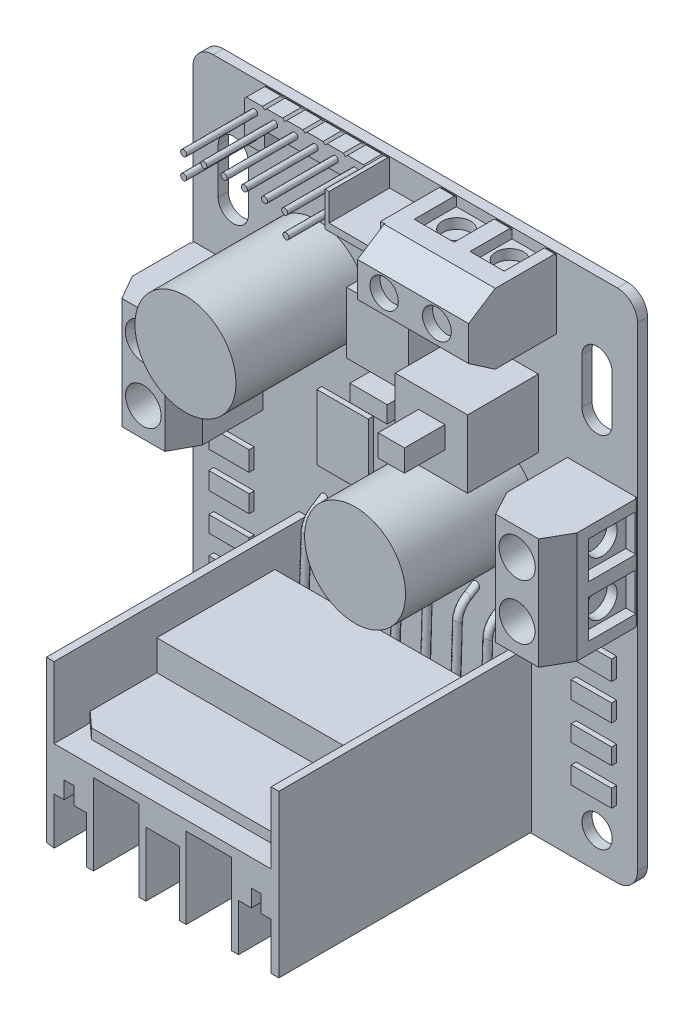
from build123d import *

# Parameters (mm, degrees)
EXTRUDE_1_DEPTH                   = 1
CUT_EXTRUDE_1_DEPTH               = 1
SKETCH_3_R                        = 1.5
CUT_EXTRUDE_2_DEPTH               = 1
EXTRUDE_3_DEPTH                   = 25
SKETCH_6_W                        = 21.473762308
SKETCH_6_H                        = 11.69385614
EXTRUDE_4_DEPTH                   = 4
EXTRUDE_5_DEPTH                   = 1
SKETCH_10_R                       = 0.374687999
PATTERN_LINEAR_1_COUNT            = 4
PATTERN_LINEAR_1_PITCH            = 3
PATTERN_LINEAR_2_COPY_1_SKETCH_R  = 0.374687999
PATTERN_LINEAR_2_COPY_2_SKETCH_R  = 0.374687999
PATTERN_LINEAR_2_COPY_3_SKETCH_R  = 0.374687999
PATTERN_LINEAR_2_COPY_4_SKETCH_R  = 0.374687999
PATTERN_LINEAR_2_COPY_5_SKETCH_R  = 0.374687999
PATTERN_LINEAR_2_COPY_6_SKETCH_R  = 0.374687999
PATTERN_LINEAR_2_COPY_7_SKETCH_R  = 0.374687999
PATTERN_LINEAR_2_COPY_8_SKETCH_R  = 0.374687999
PATTERN_LINEAR_2_COPY_9_SKETCH_R  = 0.374687999
PATTERN_LINEAR_2_COPY_10_SKETCH_R = 0.374687999
PATTERN_LINEAR_2_COPY_11_SKETCH_R = 0.374687999
PATTERN_LINEAR_2_COPY_12_SKETCH_R = 0.374687999
SKETCH_11_R                       = 5
EXTRUDE_6_DEPTH                   = 13
SKETCH_12_W                       = 7.163361861
SKETCH_12_H                       = 6.729218718
EXTRUDE_7_DEPTH                   = 7
SKETCH_13_W                       = 2.604858859
SKETCH_13_H                       = 2.170715715
EXTRUDE_8_DEPTH                   = 4
SKETCH_14_W                       = 6.150361194
SKETCH_14_H                       = 6.078004003
EXTRUDE_9_DEPTH                   = 4
SKETCH_16_W                       = 3.690216716
SKETCH_16_H                       = 1.664215382
EXTRUDE_10_DEPTH                  = 2
SKETCH_17_W                       = 6.934767777
SKETCH_17_H                       = 11
EXTRUDE_11_DEPTH                  = 6
EXTRUDE_12_DEPTH                  = 11
SKETCH_19_R                       = 1.793982188
SKETCH_19_R_2                     = 1.765947283
CUT_EXTRUDE_3_DEPTH               = 3
SKETCH_20_W                       = 4.709192755
SKETCH_20_H                       = 3.67905684
SKETCH_20_H_2                     = 3.777165022
CUT_EXTRUDE_4_DEPTH               = 1
SKETCH_21_R                       = 1.5
CUT_EXTRUDE_5_DEPTH               = 1
SKETCH_22_W                       = 11
SKETCH_22_H                       = 6.93
EXTRUDE_13_DEPTH                  = 5
EXTRUDE_14_DEPTH                  = 11
SKETCH_24_R                       = 1.402346851
SKETCH_24_R_2                     = 1.424019213
CUT_EXTRUDE_6_DEPTH               = 1
SKETCH_25_W                       = 3.942075137
SKETCH_25_H                       = 4.164435232
SKETCH_25_W_2                     = 3.385546883
CUT_EXTRUDE_7_DEPTH               = 1
EXTRUDE_15_DEPTH                  = 6
EXTRUDE_16_DEPTH                  = 2
SKETCH_28_R                       = 0.3
EXTRUDE_17_DEPTH                  = 7
SKETCH_29_W                       = 5.09290206
SKETCH_29_H                       = 6.469362075
SKETCH_29_W_2                     = 3.998616346
SKETCH_29_H_2                     = 1.942185083
SKETCH_29_H_3                     = 1.71369272
SKETCH_29_H_4                     = 1.599446538
EXTRUDE_18_DEPTH                  = 0.5
SKETCH_30_W                       = 28.912508596
SKETCH_30_H                       = 0.180940375
CUT_EXTRUDE_8_DEPTH               = 0.1
SKETCH_32_W                       = 0.154131385
SKETCH_32_H                       = 11
CUT_EXTRUDE_9_DEPTH               = 0.1
SKETCH_33_W                       = 0.2522547
SKETCH_33_H                       = 11
CUT_EXTRUDE_10_DEPTH              = 0.1
SKETCH_34_R                       = 1.39504228
SKETCH_34_R_2                     = 1.375059009
CUT_EXTRUDE_12_DEPTH              = 1


with BuildPart() as part:
    # 草图1 → 凸台-拉伸1 (new body)
    with BuildSketch(Plane.XY):
        with BuildLine():
            Line((-20, 25.5), (20, 25.5))
            ThreePointArc((20, 25.5), (21.414213562, 24.914213562), (22, 23.5))
            Line((22, 23.5), (22, -23.5))
            ThreePointArc((22, -23.5), (21.414213562, -24.914213562), (20, -25.5))
            Line((20, -25.5), (-20, -25.5))
            ThreePointArc((-20, -25.5), (-21.414213562, -24.914213562), (-22, -23.5))
            Line((-22, -23.5), (-22, 23.5))
            ThreePointArc((-22, 23.5), (-21.414213562, 24.914213562), (-20, 25.5))
        make_face()
    extrude(amount=EXTRUDE_1_DEPTH)

    # 草图2 → 切除-拉伸1 (cut)
    with BuildSketch(Plane.XY.offset(1)):
        with BuildLine():
            Line((19.5, 18), (19.5, 13.514620856))
            ThreePointArc((19.5, 13.514620856), (18, 12.014620856), (16.5, 13.514620856))
            Line((16.5, 13.514620856), (16.5, 18))
            ThreePointArc((16.5, 18), (18, 19.5), (19.5, 18))
        make_face()
    cut_extrude_1 = extrude(amount=-CUT_EXTRUDE_1_DEPTH, mode=Mode.SUBTRACT)

    # 草图3 → 切除-拉伸2 (cut)
    with BuildSketch(Plane.XY.offset(1)):
        with Locations((18, -22)):
            Circle(SKETCH_3_R)
    cut_extrude_2 = extrude(amount=-CUT_EXTRUDE_2_DEPTH, mode=Mode.SUBTRACT)

    # 镜向2: 切除-拉伸1, 切除-拉伸2 across plane
    add(cut_extrude_1.mirror(Plane(origin=(0, 0, 0), x_dir=(0, 0, 1), z_dir=(1, 0, 0))), mode=Mode.SUBTRACT)
    add(cut_extrude_2.mirror(Plane(origin=(0, 0, 0), x_dir=(0, 0, 1), z_dir=(1, 0, 0))), mode=Mode.SUBTRACT)

    # 草图5 → 凸台-拉伸3 (add)
    with BuildSketch(Plane.XY.offset(1)):
        Polygon((0, -19.045578098), (0, -16.432198343), (-10.736881154, -16.432198343), (-10.736881154, -9.4), (-11.5, -9.4), (-11.5, -25.279591788), (-10.736881154, -25.4), (-10.736881154, -20.750988826), (-9.762360738, -20.750988826), (-9.762360738, -19.045578098), (-8.787840322, -19.045578098), (-8.787840322, -20.750988826), (-7.508782276, -20.750988826), (-7.508782276, -25.4), (-6.83879949, -25.4), (-6.83879949, -17.4), (-2.331642565, -17.4), (-2.331642565, -25.4), (-1.661659779, -25.4), (-1.661659779, -19.045578098), align=None)
        Polygon((10.736881154, -16.432198343), (0, -16.432198343), (0, -19.045578098), (1.661659779, -19.045578098), (1.661659779, -25.4), (2.331642565, -25.4), (2.331642565, -17.4), (6.83879949, -17.4), (6.83879949, -25.4), (7.508782276, -25.4), (7.508782276, -20.750988826), (8.787840322, -20.750988826), (8.787840322, -19.045578098), (9.762360738, -19.045578098), (9.762360738, -20.750988826), (10.736881154, -20.750988826), (10.736881154, -25.4), (11.5, -25.4), (11.5, -9.4), (10.736881154, -9.4), align=None)
    extrude(amount=EXTRUDE_3_DEPTH)

    # 草图6 → 凸台-拉伸4 (add)
    with BuildSketch(Plane(origin=(0, -16.432198343, 0), x_dir=(1, 0, 0), z_dir=(0, 1, 0))):
        with Locations((0, -9.992511829)):
            Rectangle(SKETCH_6_W, SKETCH_6_H)
    extrude(amount=EXTRUDE_4_DEPTH)

    # 草图7 → 凸台-拉伸5 (add)
    with BuildSketch(Plane(origin=(0, -16.432198343, 0), x_dir=(1, 0, 0), z_dir=(0, 1, 0))):
        Polygon((0, -15.839439899), (-10.736881154, -15.839439899), (-10.736881154, -22.429621538), (-9.250825668, -23.790747588), (0, -23.790747588), align=None)
        Polygon((10.736881154, -15.839439899), (0, -15.839439899), (0, -23.790747588), (9.251160671, -23.790747588), (10.736881154, -22.429439899), align=None)
    extrude(amount=EXTRUDE_5_DEPTH)

    # 扫描1: sweep along a path in 草图8
    with BuildLine(Plane(origin=(0, 0, 0), x_dir=(0, 0, -1), z_dir=(1, 0, 0))) as sweep_1_path:
        Line((-1, -6.984210738), (-1.881443841, -7.540171838))
        ThreePointArc((-1.881443841, -7.540171838), (-2.550996098, -8.239576199), (-2.813565365, -9.171522584))
        Line((-2.813565365, -9.171522584), (-3.034686077, -16.506083121))
    # 草图10 → 扫描1 (sweep)
    with BuildSketch(Plane.XY.offset(1)):
        with Locations((0, -6.976397966)):
            Circle(SKETCH_10_R)
    sweep_1 = sweep(path=sweep_1_path.line)

    # 阵列(线性)1: 扫描1 ×4
    with Locations(*[(-i * PATTERN_LINEAR_1_PITCH, 0, 0) for i in range(1, PATTERN_LINEAR_1_COUNT)]):
        add(sweep_1)

    # 阵列(线性)2 copy 1: sweep along a path in 阵列(线性)2 copy 1 path
    with BuildLine(Plane(origin=(0, 0, 0), x_dir=(0, 0, -1), z_dir=(1, 0, 0))) as pattern_linear_2_copy_1_path:
        Line((-1, -6.984210738), (-1.881443841, -7.540171838))
        ThreePointArc((-1.881443841, -7.540171838), (-2.550996098, -8.239576199), (-2.813565365, -9.171522584))
        Line((-2.813565365, -9.171522584), (-3.034686077, -16.506083121))
    # 阵列(线性)2 copy 1 sketch → 阵列(线性)2 copy 1 (sweep)
    with BuildSketch(Plane.XY.offset(1)):
        with Locations((0, -6.976397966)):
            Circle(PATTERN_LINEAR_2_COPY_1_SKETCH_R)
    sweep(path=pattern_linear_2_copy_1_path.line)

    # 阵列(线性)2 copy 2: sweep along a path in 阵列(线性)2 copy 2 path
    with BuildLine(Plane(origin=(3, 0, 0), x_dir=(0, 0, -1), z_dir=(1, 0, 0))) as pattern_linear_2_copy_2_path:
        Line((-1, -6.984210738), (-1.881443841, -7.540171838))
        ThreePointArc((-1.881443841, -7.540171838), (-2.550996098, -8.239576199), (-2.813565365, -9.171522584))
        Line((-2.813565365, -9.171522584), (-3.034686077, -16.506083121))
    # 阵列(线性)2 copy 2 sketch → 阵列(线性)2 copy 2 (sweep)
    with BuildSketch(Plane(origin=(3, 0, 1), x_dir=(1, 0, 0), z_dir=(0, 0, 1))):
        with Locations((0, -6.976397966)):
            Circle(PATTERN_LINEAR_2_COPY_2_SKETCH_R)
    sweep(path=pattern_linear_2_copy_2_path.line)

    # 阵列(线性)2 copy 3: sweep along a path in 阵列(线性)2 copy 3 path
    with BuildLine(Plane(origin=(6, 0, 0), x_dir=(0, 0, -1), z_dir=(1, 0, 0))) as pattern_linear_2_copy_3_path:
        Line((-1, -6.984210738), (-1.881443841, -7.540171838))
        ThreePointArc((-1.881443841, -7.540171838), (-2.550996098, -8.239576199), (-2.813565365, -9.171522584))
        Line((-2.813565365, -9.171522584), (-3.034686077, -16.506083121))
    # 阵列(线性)2 copy 3 sketch → 阵列(线性)2 copy 3 (sweep)
    with BuildSketch(Plane(origin=(6, 0, 1), x_dir=(1, 0, 0), z_dir=(0, 0, 1))):
        with Locations((0, -6.976397966)):
            Circle(PATTERN_LINEAR_2_COPY_3_SKETCH_R)
    sweep(path=pattern_linear_2_copy_3_path.line)

    # 阵列(线性)2 copy 4: sweep along a path in 阵列(线性)2 copy 4 path
    with BuildLine(Plane(origin=(-3, 0, 0), x_dir=(0, 0, -1), z_dir=(1, 0, 0))) as pattern_linear_2_copy_4_path:
        Line((-1, -6.984210738), (-1.881443841, -7.540171838))
        ThreePointArc((-1.881443841, -7.540171838), (-2.550996098, -8.239576199), (-2.813565365, -9.171522584))
        Line((-2.813565365, -9.171522584), (-3.034686077, -16.506083121))
    # 阵列(线性)2 copy 4 sketch → 阵列(线性)2 copy 4 (sweep)
    with BuildSketch(Plane(origin=(-3, 0, 1), x_dir=(1, 0, 0), z_dir=(0, 0, 1))):
        with Locations((0, -6.976397966)):
            Circle(PATTERN_LINEAR_2_COPY_4_SKETCH_R)
    sweep(path=pattern_linear_2_copy_4_path.line)

    # 阵列(线性)2 copy 5: sweep along a path in 阵列(线性)2 copy 5 path
    with BuildLine(Plane(origin=(0, 0, 0), x_dir=(0, 0, -1), z_dir=(1, 0, 0))) as pattern_linear_2_copy_5_path:
        Line((-1, -6.984210738), (-1.881443841, -7.540171838))
        ThreePointArc((-1.881443841, -7.540171838), (-2.550996098, -8.239576199), (-2.813565365, -9.171522584))
        Line((-2.813565365, -9.171522584), (-3.034686077, -16.506083121))
    # 阵列(线性)2 copy 5 sketch → 阵列(线性)2 copy 5 (sweep)
    with BuildSketch(Plane.XY.offset(1)):
        with Locations((0, -6.976397966)):
            Circle(PATTERN_LINEAR_2_COPY_5_SKETCH_R)
    sweep(path=pattern_linear_2_copy_5_path.line)

    # 阵列(线性)2 copy 6: sweep along a path in 阵列(线性)2 copy 6 path
    with BuildLine(Plane(origin=(3, 0, 0), x_dir=(0, 0, -1), z_dir=(1, 0, 0))) as pattern_linear_2_copy_6_path:
        Line((-1, -6.984210738), (-1.881443841, -7.540171838))
        ThreePointArc((-1.881443841, -7.540171838), (-2.550996098, -8.239576199), (-2.813565365, -9.171522584))
        Line((-2.813565365, -9.171522584), (-3.034686077, -16.506083121))
    # 阵列(线性)2 copy 6 sketch → 阵列(线性)2 copy 6 (sweep)
    with BuildSketch(Plane(origin=(3, 0, 1), x_dir=(1, 0, 0), z_dir=(0, 0, 1))):
        with Locations((0, -6.976397966)):
            Circle(PATTERN_LINEAR_2_COPY_6_SKETCH_R)
    sweep(path=pattern_linear_2_copy_6_path.line)

    # 阵列(线性)2 copy 7: sweep along a path in 阵列(线性)2 copy 7 path
    with BuildLine(Plane(origin=(-6, 0, 0), x_dir=(0, 0, -1), z_dir=(1, 0, 0))) as pattern_linear_2_copy_7_path:
        Line((-1, -6.984210738), (-1.881443841, -7.540171838))
        ThreePointArc((-1.881443841, -7.540171838), (-2.550996098, -8.239576199), (-2.813565365, -9.171522584))
        Line((-2.813565365, -9.171522584), (-3.034686077, -16.506083121))
    # 阵列(线性)2 copy 7 sketch → 阵列(线性)2 copy 7 (sweep)
    with BuildSketch(Plane(origin=(-6, 0, 1), x_dir=(1, 0, 0), z_dir=(0, 0, 1))):
        with Locations((0, -6.976397966)):
            Circle(PATTERN_LINEAR_2_COPY_7_SKETCH_R)
    sweep(path=pattern_linear_2_copy_7_path.line)

    # 阵列(线性)2 copy 8: sweep along a path in 阵列(线性)2 copy 8 path
    with BuildLine(Plane(origin=(-3, 0, 0), x_dir=(0, 0, -1), z_dir=(1, 0, 0))) as pattern_linear_2_copy_8_path:
        Line((-1, -6.984210738), (-1.881443841, -7.540171838))
        ThreePointArc((-1.881443841, -7.540171838), (-2.550996098, -8.239576199), (-2.813565365, -9.171522584))
        Line((-2.813565365, -9.171522584), (-3.034686077, -16.506083121))
    # 阵列(线性)2 copy 8 sketch → 阵列(线性)2 copy 8 (sweep)
    with BuildSketch(Plane(origin=(-3, 0, 1), x_dir=(1, 0, 0), z_dir=(0, 0, 1))):
        with Locations((0, -6.976397966)):
            Circle(PATTERN_LINEAR_2_COPY_8_SKETCH_R)
    sweep(path=pattern_linear_2_copy_8_path.line)

    # 阵列(线性)2 copy 9: sweep along a path in 阵列(线性)2 copy 9 path
    with BuildLine(Plane(origin=(0, 0, 0), x_dir=(0, 0, -1), z_dir=(1, 0, 0))) as pattern_linear_2_copy_9_path:
        Line((-1, -6.984210738), (-1.881443841, -7.540171838))
        ThreePointArc((-1.881443841, -7.540171838), (-2.550996098, -8.239576199), (-2.813565365, -9.171522584))
        Line((-2.813565365, -9.171522584), (-3.034686077, -16.506083121))
    # 阵列(线性)2 copy 9 sketch → 阵列(线性)2 copy 9 (sweep)
    with BuildSketch(Plane.XY.offset(1)):
        with Locations((0, -6.976397966)):
            Circle(PATTERN_LINEAR_2_COPY_9_SKETCH_R)
    sweep(path=pattern_linear_2_copy_9_path.line)

    # 阵列(线性)2 copy 10: sweep along a path in 阵列(线性)2 copy 10 path
    with BuildLine(Plane(origin=(3, 0, 0), x_dir=(0, 0, -1), z_dir=(1, 0, 0))) as pattern_linear_2_copy_10_path:
        Line((-1, -6.984210738), (-1.881443841, -7.540171838))
        ThreePointArc((-1.881443841, -7.540171838), (-2.550996098, -8.239576199), (-2.813565365, -9.171522584))
        Line((-2.813565365, -9.171522584), (-3.034686077, -16.506083121))
    # 阵列(线性)2 copy 10 sketch → 阵列(线性)2 copy 10 (sweep)
    with BuildSketch(Plane(origin=(3, 0, 1), x_dir=(1, 0, 0), z_dir=(0, 0, 1))):
        with Locations((0, -6.976397966)):
            Circle(PATTERN_LINEAR_2_COPY_10_SKETCH_R)
    sweep(path=pattern_linear_2_copy_10_path.line)

    # 阵列(线性)2 copy 11: sweep along a path in 阵列(线性)2 copy 11 path
    with BuildLine(Plane(origin=(6, 0, 0), x_dir=(0, 0, -1), z_dir=(1, 0, 0))) as pattern_linear_2_copy_11_path:
        Line((-1, -6.984210738), (-1.881443841, -7.540171838))
        ThreePointArc((-1.881443841, -7.540171838), (-2.550996098, -8.239576199), (-2.813565365, -9.171522584))
        Line((-2.813565365, -9.171522584), (-3.034686077, -16.506083121))
    # 阵列(线性)2 copy 11 sketch → 阵列(线性)2 copy 11 (sweep)
    with BuildSketch(Plane(origin=(6, 0, 1), x_dir=(1, 0, 0), z_dir=(0, 0, 1))):
        with Locations((0, -6.976397966)):
            Circle(PATTERN_LINEAR_2_COPY_11_SKETCH_R)
    sweep(path=pattern_linear_2_copy_11_path.line)

    # 阵列(线性)2 copy 12: sweep along a path in 阵列(线性)2 copy 12 path
    with BuildLine(Plane(origin=(9, 0, 0), x_dir=(0, 0, -1), z_dir=(1, 0, 0))) as pattern_linear_2_copy_12_path:
        Line((-1, -6.984210738), (-1.881443841, -7.540171838))
        ThreePointArc((-1.881443841, -7.540171838), (-2.550996098, -8.239576199), (-2.813565365, -9.171522584))
        Line((-2.813565365, -9.171522584), (-3.034686077, -16.506083121))
    # 阵列(线性)2 copy 12 sketch → 阵列(线性)2 copy 12 (sweep)
    with BuildSketch(Plane(origin=(9, 0, 1), x_dir=(1, 0, 0), z_dir=(0, 0, 1))):
        with Locations((0, -6.976397966)):
            Circle(PATTERN_LINEAR_2_COPY_12_SKETCH_R)
    sweep(path=pattern_linear_2_copy_12_path.line)

    # 草图11 → 凸台-拉伸6 (add)
    with BuildSketch(Plane.XY.offset(1)):
        with Locations(Location((-9.738812685, 11.461500188, 0), (0, 0, 180))):
            Circle(SKETCH_11_R)
        with Locations(Location((7.048055514, 1.765636659, 0), (0, 0, 180))):
            Circle(SKETCH_11_R)
    extrude(amount=EXTRUDE_6_DEPTH)

    # 草图12 → 凸台-拉伸7 (add)
    with BuildSketch(Plane.XY.offset(1)):
        with Locations((8.603735111, 10.846464069)):
            Rectangle(SKETCH_12_W, SKETCH_12_H)
    extrude(amount=EXTRUDE_7_DEPTH)

    # 草图13 → 凸台-拉伸8 (add)
    with BuildSketch(Plane.XY.offset(8)):
        with Locations((8.639913705, 11.172071427)):
            Rectangle(SKETCH_13_W, SKETCH_13_H)
    extrude(amount=EXTRUDE_8_DEPTH)

    # 草图14 → 凸台-拉伸9 (add)
    with BuildSketch(Plane.XY.offset(1)):
        with Locations((0.282658201, 13.125715571)):
            Rectangle(SKETCH_14_W, SKETCH_14_H)
    extrude(amount=EXTRUDE_9_DEPTH)

    # 草图16 → 凸台-拉伸10 (add)
    with BuildSketch(Plane.XY.offset(1)):
        with Locations((-2.611629419, 5.274960399)):
            Rectangle(SKETCH_16_W, SKETCH_16_H)
    extrude(amount=EXTRUDE_10_DEPTH)

    # 草图17 → 凸台-拉伸11 (add)
    with BuildSketch(Plane.XY.offset(1)):
        with Locations((18.532616112, 3)):
            Rectangle(SKETCH_17_W, SKETCH_17_H)
    extrude(amount=EXTRUDE_11_DEPTH)

    # 草图18 → 凸台-拉伸12 (add)
    with BuildSketch(Plane(origin=(0, 8.5, 0), x_dir=(1, 0, 0), z_dir=(0, 1, 0))):
        Polygon((15.065232223, -1), (15.065232223, -7), (16.372176741, -9.407131192), (20.624174685, -9.407131192), (22, -7), (22, -1), align=None)
    extrude_12 = extrude(amount=-EXTRUDE_12_DEPTH)

    # 镜向3: 凸台-拉伸12 across plane
    add(extrude_12.mirror(Plane(origin=(0, 0, 0), x_dir=(0, 0, 1), z_dir=(1, 0, 0))))

    # 草图19 → 切除-拉伸3 (cut)
    with BuildSketch(Plane.XY.offset(9.407131192)):
        with Locations((18.498175713, 5.85485006)):
            Circle(SKETCH_19_R)
        with Locations((18.498175713, 0.35485006)):
            Circle(SKETCH_19_R_2)
    cut_extrude_3 = extrude(amount=-CUT_EXTRUDE_3_DEPTH, mode=Mode.SUBTRACT)

    # 镜向4: 切除-拉伸3 across plane
    add(cut_extrude_3.mirror(Plane(origin=(0, 0, 0), x_dir=(0, 0, 1), z_dir=(1, 0, 0))), mode=Mode.SUBTRACT)

    # 草图20 → 切除-拉伸4 (cut)
    with BuildSketch(Plane(origin=(22, 0, 0), x_dir=(0, 0, -1), z_dir=(1, 0, 0))):
        with Locations((-3.507343783, 5.579110773)):
            Rectangle(SKETCH_20_W, SKETCH_20_H)
        with Locations((-3.507343783, 0.526539379)):
            Rectangle(SKETCH_20_W, SKETCH_20_H_2)
    cut_extrude_4 = extrude(amount=-CUT_EXTRUDE_4_DEPTH, mode=Mode.SUBTRACT)

    # 镜向5: 切除-拉伸4 across plane
    add(cut_extrude_4.mirror(Plane(origin=(0, 0, 0), x_dir=(0, 0, 1), z_dir=(1, 0, 0))), mode=Mode.SUBTRACT)

    # 草图21 → 切除-拉伸5 (cut)
    with BuildSketch(Plane(origin=(21, 0, 0), x_dir=(0, 0, -1), z_dir=(1, 0, 0))):
        with Locations((-3.507343782, 5.750800092)):
            Circle(SKETCH_21_R)
        with Locations((-3.507343782, 0.403904151)):
            Circle(SKETCH_21_R)
    cut_extrude_5 = extrude(amount=-CUT_EXTRUDE_5_DEPTH, mode=Mode.SUBTRACT)

    # 镜向6: 切除-拉伸5 across plane
    add(cut_extrude_5.mirror(Plane(origin=(0, 0, 0), x_dir=(0, 0, 1), z_dir=(1, 0, 0))), mode=Mode.SUBTRACT)

    # 草图22 → 凸台-拉伸13 (add)
    with BuildSketch(Plane.XY.offset(1)):
        with Locations((8.5, 22.035)):
            Rectangle(SKETCH_22_W, SKETCH_22_H)
    extrude(amount=EXTRUDE_13_DEPTH)

    # 草图23 → 凸台-拉伸14 (add)
    with BuildSketch(Plane(origin=(14, 0, 0), x_dir=(0, 0, -1), z_dir=(1, 0, 0))):
        Polygon((-1, 25.5), (-7.077420697, 25.5), (-9.710292302, 23.798679324), (-9.710292302, 20.364498968), (-7.077420697, 18.57), (-1, 18.57), align=None)
    extrude(amount=-EXTRUDE_14_DEPTH)

    # 草图24 → 切除-拉伸6 (cut)
    with BuildSketch(Plane.XY.offset(9.710292302)):
        with Locations((5.635685346, 22.221670668)):
            Circle(SKETCH_24_R)
        with Locations((10.859386864, 22.221670668)):
            Circle(SKETCH_24_R_2)
    extrude(amount=-CUT_EXTRUDE_6_DEPTH, mode=Mode.SUBTRACT)

    # 草图25 → 切除-拉伸7 (cut)
    with BuildSketch(Plane(origin=(0, 25.5, 0), x_dir=(1, 0, 0), z_dir=(0, 1, 0))):
        with Locations((6.03952861, -3.082217616)):
            Rectangle(SKETCH_25_W, SKETCH_25_H)
        with Locations((11.280169675, -3.082217616)):
            Rectangle(SKETCH_25_W_2, SKETCH_25_H)
    extrude(amount=-CUT_EXTRUDE_7_DEPTH, mode=Mode.SUBTRACT)

    # 草图26 → 凸台-拉伸15 (add)
    with BuildSketch(Plane.XY.offset(1)):
        Polygon((-2.525668425, 25.5), (-2.912508596, 25.5), (-2.912508596, 22.081589146), (3, 22.081589146), (3, 25.5), (2.585984387, 25.5), (2.585984387, 22.7938855), (-2.525668425, 22.7938855), align=None)
    extrude(amount=EXTRUDE_15_DEPTH)

    # 草图27 → 凸台-拉伸16 (add)
    with BuildSketch(Plane.XY.offset(1)):
        Polygon((-14.912508596, 25.295340855), (-14.707849451, 25.5), (-13.117167741, 25.5), (-12.912508596, 25.295340855), (-12.912508596, 23.704659145), (-13.117167741, 23.5), (-14.707849451, 23.5), (-14.912508596, 23.704659145), align=None)
        Polygon((-13.117167741, 21.5), (-14.707849451, 21.5), (-14.912508596, 21.704659145), (-14.912508596, 23.295340855), (-14.707849451, 23.5), (-13.117167741, 23.5), (-12.912508596, 23.295340855), (-12.912508596, 21.704659145), align=None)
        Polygon((-11.117167741, 25.5), (-10.912508596, 25.295340855), (-10.912508596, 23.704659145), (-11.117167741, 23.5), (-12.707849451, 23.5), (-12.912508596, 23.704659145), (-12.912508596, 25.295340855), (-12.707849451, 25.5), align=None)
        Polygon((-10.912508596, 25.295340855), (-10.707849451, 25.5), (-9.117167741, 25.5), (-8.912508596, 25.295340855), (-8.912508596, 23.704659145), (-9.117167741, 23.5), (-10.707849451, 23.5), (-10.912508596, 23.704659145), align=None)
        Polygon((-8.912508596, 25.295340855), (-8.707849451, 25.5), (-7.117167741, 25.5), (-6.912508596, 25.295340855), (-6.912508596, 23.704659145), (-7.117167741, 23.5), (-8.707849451, 23.5), (-8.912508596, 23.704659145), align=None)
        Polygon((-6.707849451, 23.5), (-6.912508596, 23.704659145), (-6.912508596, 25.295340855), (-6.707849451, 25.5), (-5.117167741, 25.5), (-4.912508596, 25.295340855), (-4.912508596, 23.704659145), (-5.117167741, 23.5), align=None)
        Polygon((-4.707849451, 23.5), (-4.912508596, 23.704659145), (-4.912508596, 25.295340855), (-4.707849451, 25.5), (-3.117167741, 25.5), (-2.912508596, 25.295340855), (-2.912508596, 23.704659145), (-3.117167741, 23.5), align=None)
        Polygon((-3.117167741, 23.5), (-2.912508596, 23.295340855), (-2.912508596, 21.704659145), (-3.117167741, 21.5), (-4.707849451, 21.5), (-4.912508596, 21.704659145), (-4.912508596, 23.295340855), (-4.707849451, 23.5), align=None)
    extrude(amount=EXTRUDE_16_DEPTH)

    # 草图28 → 凸台-拉伸17 (add)
    with BuildSketch(Plane.XY.offset(3)):
        with Locations((-13.912508596, 24.590637349)):
            Circle(SKETCH_28_R)
        with Locations((-11.912508596, 24.590637349)):
            Circle(SKETCH_28_R)
        with Locations((-9.912508596, 24.590637349)):
            Circle(SKETCH_28_R)
        with Locations((-7.912508596, 24.590637349)):
            Circle(SKETCH_28_R)
        with Locations((-5.912508596, 24.590637349)):
            Circle(SKETCH_28_R)
        with Locations((-3.912508596, 24.590637349)):
            Circle(SKETCH_28_R)
        with Locations((-13.912508596, 22.54076345)):
            Circle(SKETCH_28_R)
        with Locations((-3.788793694, 22.54076345)):
            Circle(SKETCH_28_R)
    extrude(amount=EXTRUDE_17_DEPTH)

    # 草图29 → 凸台-拉伸18 (add)
    with BuildSketch(Plane.XY.offset(1)):
        with Locations((-6.691938441, -0.805402659)):
            Rectangle(SKETCH_29_W, SKETCH_29_H)
        with Locations((17.932587131, -7.061447844)):
            Rectangle(SKETCH_29_W_2, SKETCH_29_H_2)
        with Locations((17.932587131, -10.717325647)):
            Rectangle(SKETCH_29_W_2, SKETCH_29_H_3)
        with Locations((17.932587131, -14.43032654)):
            Rectangle(SKETCH_29_W_2, SKETCH_29_H_4)
        with Locations((17.932587131, -18.029081252)):
            Rectangle(SKETCH_29_W_2, SKETCH_29_H_3)
        with Locations((-17.932587131, -18.029081252)):
            Rectangle(SKETCH_29_W_2, SKETCH_29_H_3)
        with Locations((-17.932587131, -14.43032654)):
            Rectangle(SKETCH_29_W_2, SKETCH_29_H_4)
        with Locations((-17.932587131, -10.717325647)):
            Rectangle(SKETCH_29_W_2, SKETCH_29_H_3)
        with Locations((-17.932587131, -7.061447844)):
            Rectangle(SKETCH_29_W_2, SKETCH_29_H_2)
    extrude(amount=EXTRUDE_18_DEPTH)

    # 草图30 → 切除-拉伸8 (cut)
    with BuildSketch(Plane(origin=(0, 25.5, 0), x_dir=(1, 0, 0), z_dir=(0, 1, 0))):
        with Locations((-0.456254298, -1.090470188)):
            Rectangle(SKETCH_30_W, SKETCH_30_H)
    extrude(amount=-CUT_EXTRUDE_8_DEPTH, mode=Mode.SUBTRACT)

    # 草图32 → 切除-拉伸9 (cut)
    with BuildSketch(Plane(origin=(22, 0, 0), x_dir=(0, 0, -1), z_dir=(1, 0, 0))):
        with Locations((-1.077065693, 3)):
            Rectangle(SKETCH_32_W, SKETCH_32_H)
    extrude(amount=-CUT_EXTRUDE_9_DEPTH, mode=Mode.SUBTRACT)

    # 草图33 → 切除-拉伸10 (cut)
    with BuildSketch(Plane.ZY.offset(22)):
        with Locations((1.12612735, 3)):
            Rectangle(SKETCH_33_W, SKETCH_33_H)
    extrude(amount=-CUT_EXTRUDE_10_DEPTH, mode=Mode.SUBTRACT)

    # 草图34 → 切除-拉伸12 (cut)
    with BuildSketch(Plane(origin=(0, 24.5, 0), x_dir=(1, 0, 0), z_dir=(0, 1, 0))):
        with Locations(Location((6.013148483, -2.917288589, 0), (0, 0, 270))):
            Circle(SKETCH_34_R)
        with Locations(Location((11.280169674, -2.917288589, 0), (0, 0, 270))):
            Circle(SKETCH_34_R_2)
    extrude(amount=-CUT_EXTRUDE_12_DEPTH, mode=Mode.SUBTRACT)


solid = part.part
